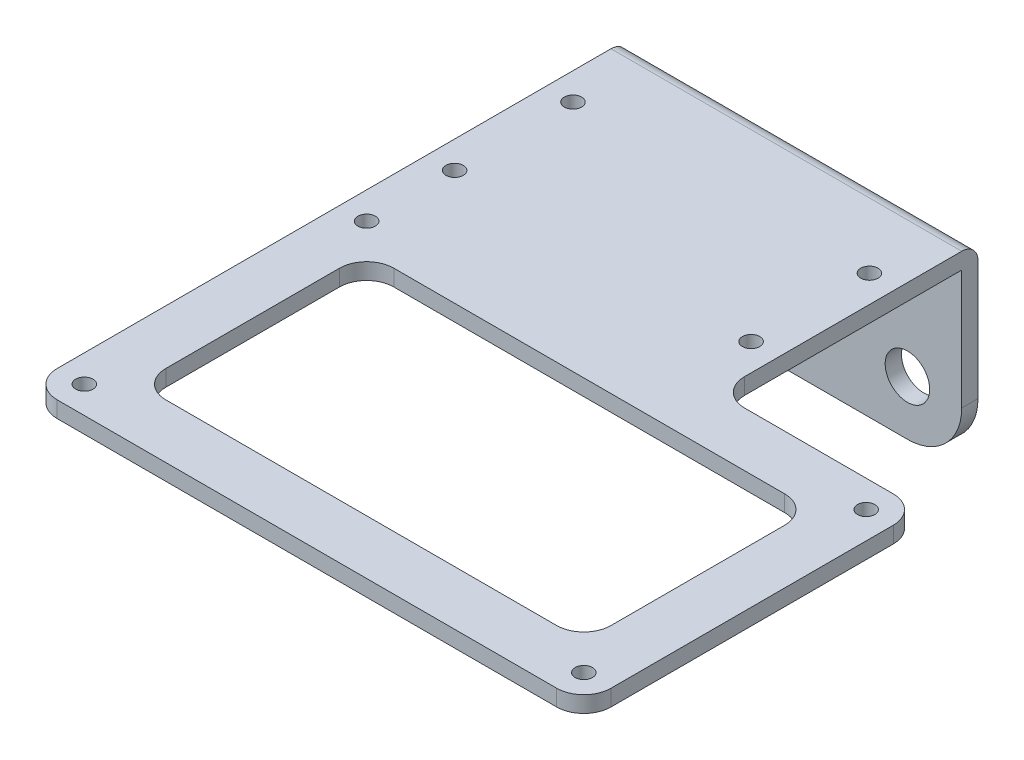
from build123d import *

# Parameters (mm, degrees)
SKETCH_1_W          = 110
SKETCH_1_H          = 110
EXTRUDE_1_DEPTH     = 3
CUT_EXTRUDE_1_REACH = 79.84
SKETCH_2_R          = 1.6
CUT_EXTRUDE_2_REACH = 79.84
SKETCH_5_W          = 64.6
SKETCH_5_H          = 3
EXTRUDE_2_DEPTH     = 32
CUT_EXTRUDE_3_REACH = 129.079
SKETCH_6_R          = 4.1
CUT_EXTRUDE_4_REACH = 87.294
FILLET_1_R          = 5
FILLET_2_R          = 3
FILLET_3_R          = 10


with BuildPart() as part:
    # 草图1 → 凸台-拉伸1 (new body)
    with BuildSketch(Plane(origin=(0, 0, 0), x_dir=(1, 0, 0), z_dir=(0, 1, 0))):
        Rectangle(SKETCH_1_W, SKETCH_1_H)
    extrude(amount=EXTRUDE_1_DEPTH)

    # 草图2 → 切除-拉伸1 (cut, up to next)
    with BuildSketch(Plane(origin=(0, 3, 0), x_dir=(1, 0, 0), z_dir=(0, 1, 0)), mode=Mode.PRIVATE) as cut_extrude_1_sk1:
        with Locations((-50, 40)):
            Circle(SKETCH_2_R)
    cut_extrude_1_tool1 = extrude(cut_extrude_1_sk1.sketch, amount=-CUT_EXTRUDE_1_REACH, mode=Mode.PRIVATE) & part.part
    # 草图2 → 切除-拉伸1 (cut, up to next)
    with BuildSketch(Plane(origin=(0, 3, 0), x_dir=(1, 0, 0), z_dir=(0, 1, 0)), mode=Mode.PRIVATE) as cut_extrude_1_sk2:
        with Locations((4.6, 40)):
            Circle(SKETCH_2_R)
    cut_extrude_1_tool2 = extrude(cut_extrude_1_sk2.sketch, amount=-CUT_EXTRUDE_1_REACH, mode=Mode.PRIVATE) & part.part
    # 草图2 → 切除-拉伸1 (cut, up to next)
    with BuildSketch(Plane(origin=(0, 3, 0), x_dir=(1, 0, 0), z_dir=(0, 1, 0)), mode=Mode.PRIVATE) as cut_extrude_1_sk3:
        with Locations((4.6, 18.2)):
            Circle(SKETCH_2_R)
    cut_extrude_1_tool3 = extrude(cut_extrude_1_sk3.sketch, amount=-CUT_EXTRUDE_1_REACH, mode=Mode.PRIVATE) & part.part
    # 草图2 → 切除-拉伸1 (cut, up to next)
    with BuildSketch(Plane(origin=(0, 3, 0), x_dir=(1, 0, 0), z_dir=(0, 1, 0)), mode=Mode.PRIVATE) as cut_extrude_1_sk4:
        with Locations((-50, 18.2)):
            Circle(SKETCH_2_R)
    cut_extrude_1_tool4 = extrude(cut_extrude_1_sk4.sketch, amount=-CUT_EXTRUDE_1_REACH, mode=Mode.PRIVATE) & part.part
    # 草图2 → 切除-拉伸1 (cut, up to next)
    with BuildSketch(Plane(origin=(0, 3, 0), x_dir=(1, 0, 0), z_dir=(0, 1, 0)), mode=Mode.PRIVATE) as cut_extrude_1_sk5:
        with Locations((-50, -50)):
            Circle(SKETCH_2_R)
    cut_extrude_1_tool5 = extrude(cut_extrude_1_sk5.sketch, amount=-CUT_EXTRUDE_1_REACH, mode=Mode.PRIVATE) & part.part
    # 草图2 → 切除-拉伸1 (cut, up to next)
    with BuildSketch(Plane(origin=(0, 3, 0), x_dir=(1, 0, 0), z_dir=(0, 1, 0)), mode=Mode.PRIVATE) as cut_extrude_1_sk6:
        with Locations((42, -50)):
            Circle(SKETCH_2_R)
    cut_extrude_1_tool6 = extrude(cut_extrude_1_sk6.sketch, amount=-CUT_EXTRUDE_1_REACH, mode=Mode.PRIVATE) & part.part
    # 草图2 → 切除-拉伸1 (cut, up to next)
    with BuildSketch(Plane(origin=(0, 3, 0), x_dir=(1, 0, 0), z_dir=(0, 1, 0)), mode=Mode.PRIVATE) as cut_extrude_1_sk7:
        with Locations((42, 2)):
            Circle(SKETCH_2_R)
    cut_extrude_1_tool7 = extrude(cut_extrude_1_sk7.sketch, amount=-CUT_EXTRUDE_1_REACH, mode=Mode.PRIVATE) & part.part
    # 草图2 → 切除-拉伸1 (cut, up to next)
    with BuildSketch(Plane(origin=(0, 3, 0), x_dir=(1, 0, 0), z_dir=(0, 1, 0)), mode=Mode.PRIVATE) as cut_extrude_1_sk8:
        with Locations((-50, 2)):
            Circle(SKETCH_2_R)
    cut_extrude_1_tool8 = extrude(cut_extrude_1_sk8.sketch, amount=-CUT_EXTRUDE_1_REACH, mode=Mode.PRIVATE) & part.part
    add(cut_extrude_1_tool1.solids().sort_by_distance((-50, 3, -40))[0], mode=Mode.SUBTRACT)
    add(cut_extrude_1_tool2.solids().sort_by_distance((4.6, 3, -40))[0], mode=Mode.SUBTRACT)
    add(cut_extrude_1_tool3.solids().sort_by_distance((4.6, 3, -18.2))[0], mode=Mode.SUBTRACT)
    add(cut_extrude_1_tool4.solids().sort_by_distance((-50, 3, -18.2))[0], mode=Mode.SUBTRACT)
    add(cut_extrude_1_tool5.solids().sort_by_distance((-50, 3, 50))[0], mode=Mode.SUBTRACT)
    add(cut_extrude_1_tool6.solids().sort_by_distance((42, 3, 50))[0], mode=Mode.SUBTRACT)
    add(cut_extrude_1_tool7.solids().sort_by_distance((42, 3, -2))[0], mode=Mode.SUBTRACT)
    add(cut_extrude_1_tool8.solids().sort_by_distance((-50, 3, -2))[0], mode=Mode.SUBTRACT)

    # 草图3 → 切除-拉伸2 (cut, up to next)
    with BuildSketch(Plane(origin=(0, 3, 0), x_dir=(1, 0, 0), z_dir=(0, 1, 0)), mode=Mode.PRIVATE) as cut_extrude_2_sk1:
        Polygon((55, 17), (55, -55), (47, -55), (47, 7), (9.6, 7), (9.6, 55), (55, 55), align=None)
    cut_extrude_2_tool1 = extrude(cut_extrude_2_sk1.sketch, amount=-CUT_EXTRUDE_2_REACH, mode=Mode.PRIVATE) & part.part
    add(cut_extrude_2_tool1.solids().sort_by_distance((35.767105, 3, -20.802632))[0], mode=Mode.SUBTRACT)

    # 草图5 → 凸台-拉伸2 (add)
    with BuildSketch(Plane.XZ):
        with Locations((-22.7, -53.5)):
            Rectangle(SKETCH_5_W, SKETCH_5_H)
    extrude(amount=EXTRUDE_2_DEPTH)

    # 草图6 → 切除-拉伸3 (cut, up to next)
    with BuildSketch(Plane(origin=(0, 0, -55), x_dir=(-1, 0, 0), z_dir=(0, 0, -1)), mode=Mode.PRIVATE) as cut_extrude_3_sk1:
        with Locations((0.4, -22)):
            Circle(SKETCH_6_R)
    cut_extrude_3_tool1 = extrude(cut_extrude_3_sk1.sketch, amount=-CUT_EXTRUDE_3_REACH, mode=Mode.PRIVATE) & part.part
    # 草图6 → 切除-拉伸3 (cut, up to next)
    with BuildSketch(Plane(origin=(0, 0, -55), x_dir=(-1, 0, 0), z_dir=(0, 0, -1)), mode=Mode.PRIVATE) as cut_extrude_3_sk2:
        with Locations((45, -22)):
            Circle(SKETCH_6_R)
    cut_extrude_3_tool2 = extrude(cut_extrude_3_sk2.sketch, amount=-CUT_EXTRUDE_3_REACH, mode=Mode.PRIVATE) & part.part
    add(cut_extrude_3_tool1.solids().sort_by_distance((-0.4, -22, -55))[0], mode=Mode.SUBTRACT)
    add(cut_extrude_3_tool2.solids().sort_by_distance((-45, -22, -55))[0], mode=Mode.SUBTRACT)

    # 草图7 → 切除-拉伸4 (cut, up to next)
    with BuildSketch(Plane(origin=(0, 3, 0), x_dir=(1, 0, 0), z_dir=(0, 1, 0)), mode=Mode.PRIVATE) as cut_extrude_4_sk1:
        with BuildLine():
            Line((-40, -3), (32, -3))
            ThreePointArc((32, -3), (35.535533906, -4.464466094), (37, -8))
            Line((37, -8), (37, -40))
            ThreePointArc((37, -40), (35.535533906, -43.535533906), (32, -45))
            Line((32, -45), (-40, -45))
            ThreePointArc((-40, -45), (-43.535533906, -43.535533906), (-45, -40))
            Line((-45, -40), (-45, -8))
            ThreePointArc((-45, -8), (-43.535533906, -4.464466094), (-40, -3))
        make_face()
    cut_extrude_4_tool1 = extrude(cut_extrude_4_sk1.sketch, amount=-CUT_EXTRUDE_4_REACH, mode=Mode.PRIVATE) & part.part
    add(cut_extrude_4_tool1.solids().sort_by_distance((-4, 3, 24))[0], mode=Mode.SUBTRACT)

    # 圆角1
    fillet_1_edges = [part.edges().sort_by_distance(p)[0] for p in [
        (9.6, 1.5, -7),
        (47, 1.5, -7),
        (47, 1.5, 55),
        (-55, 1.5, 55),
    ]]
    fillet(fillet_1_edges, radius=FILLET_1_R)

    # 圆角2
    fillet_2_edges = [part.edges().sort_by_distance(p)[0] for p in [
        (-22.7, 3, -55),
    ]]
    fillet(fillet_2_edges, radius=FILLET_2_R)

    # 圆角3
    fillet_3_edges = [part.edges().sort_by_distance(p)[0] for p in [
        (-55, -32, -53.5),
        (9.6, -32, -53.5),
    ]]
    fillet(fillet_3_edges, radius=FILLET_3_R)


solid = part.part
